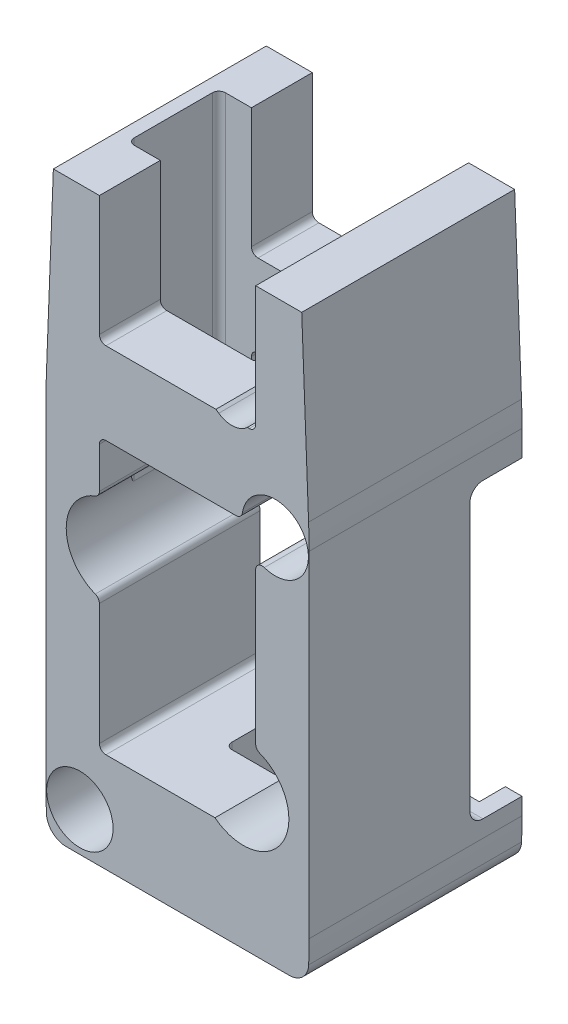
from build123d import *

# Parameters (mm, degrees)
SKETCH1_R               = 7.95
SKETCH1_R_2             = 3
MAIN_BODY_LINK_B1_DEPTH = 32.7
CUT_EXTRUDE2_REACH      = 172.091
CUT_EXTRUDE3_REACH      = 172.091
SKETCH5_R               = 1.5
PULLEYIDLERUP_DEPTH     = 32.7
CUT_EXTRUDE5_DEPTH      = 32.7
FILLET5_R               = 100
SKETCH8_R               = 15.25
CUT_EXTRUDE6_DEPTH      = 171.090551712
SKETCH9_R               = 5.1
SKETCH9_W               = 38.1446978
SKETCH9_H               = 45.516821784
SKETCH9_W_2             = 39.989573096
SKETCH9_H_2             = 49.024052381
CUT_EXTRUDE7_DEPTH      = 171.090551712
SKETCH10_W              = 24
SKETCH10_H              = 41.8
SKETCH10_H_2            = 19.483178216
CUT_EXTRUDE8_DEPTH      = 127.171046068
SKETCH12_R              = 7
CUT_EXTRUDE13_DEPTH     = 127.171046068
SKETCH16_W              = 40.4
SKETCH16_H              = 45
CUT_EXTRUDE18_DEPTH     = 8
SKETCH18_W              = 20
SKETCH18_H              = 14
CUT_EXTRUDE19_DEPTH     = 47
SKETCH19_W              = 20
SKETCH19_H              = 12
CUT_EXTRUDE20_DEPTH     = 20
CUT_EXTRUDE21_DEPTH     = 4
FILLET6_R               = 3
FILLET7_R               = 1
FILLET8_R               = 1
FILLET9_R               = 2


with BuildPart() as part:
    # Sketch1 → Main Body Link B1 (new body)
    with BuildSketch(Plane.XY):
        with BuildLine():
            Line((20.2, 41.674052381), (20.2, 83.474052381))
            Line((20.2, 83.474052381), (20.2, 90.874052381))
            Line((20.2, 90.874052381), (17.986683974, 148.383116621))
            ThreePointArc((17.986683974, 148.383116621), (0, 165.690874165), (-17.986683974, 148.383116621))
            Line((-17.986683974, 148.383116621), (-20.2, 90.874052381))
            Line((-20.2, 90.874052381), (-20.2, 83.474052381))
            Line((-20.2, 83.474052381), (-20.2, 41.674052381))
            Line((-20.2, 41.674052381), (-20.2, 34.274052381))
            Line((-20.2, 34.274052381), (-17.964224051, -1.134307826))
            ThreePointArc((-17.964224051, -1.134307826), (0, -18), (17.964224051, -1.134307826))
            Line((17.964224051, -1.134307826), (20.2, 34.274052381))
            Line((20.2, 34.274052381), (20.2, 41.674052381))
        make_face()
        Circle(SKETCH1_R, mode=Mode.SUBTRACT)
        with Locations((15, 88.174052381)):
            Circle(SKETCH1_R_2, mode=Mode.SUBTRACT)
        with Locations((-15, 37.024052381)):
            Circle(SKETCH1_R_2, mode=Mode.SUBTRACT)
        with Locations((0, 147.690874165)):
            Circle(SKETCH1_R, mode=Mode.SUBTRACT)
    extrude(amount=MAIN_BODY_LINK_B1_DEPTH)

    # Sketch4 → Cut-Extrude2 (cut, up to next)
    with BuildSketch(Plane.XY.offset(32.7), mode=Mode.PRIVATE) as cut_extrude2_sk1:
        with BuildLine():
            Line((-12, 134.2744663), (-12, 123.584968066))
            Line((-12, 123.584968066), (-2.929911079, 129.930929878))
            ThreePointArc((-2.929911079, 129.930929878), (-7.774454217, 131.456408925), (-12, 134.2744663))
        make_face()
    cut_extrude2_tool1 = extrude(cut_extrude2_sk1.sketch, amount=-CUT_EXTRUDE2_REACH, mode=Mode.PRIVATE) & part.part
    # Sketch4 → Cut-Extrude2 (cut, up to next)
    with BuildSketch(Plane.XY.offset(32.7), mode=Mode.PRIVATE) as cut_extrude2_sk2:
        Polygon((-12, 100.690874165), (3.278172542, 100.690874165), (-12, 111.380372399), align=None)
    cut_extrude2_tool2 = extrude(cut_extrude2_sk2.sketch, amount=-CUT_EXTRUDE2_REACH, mode=Mode.PRIVATE) & part.part
    # Sketch4 → Cut-Extrude2 (cut, up to next)
    with BuildSketch(Plane.XY.offset(32.7), mode=Mode.PRIVATE) as cut_extrude2_sk3:
        Polygon((12, 128.172168466), (12, 106.793171999), (-3.278172542, 117.482670232), align=None)
    cut_extrude2_tool3 = extrude(cut_extrude2_sk3.sketch, amount=-CUT_EXTRUDE2_REACH, mode=Mode.PRIVATE) & part.part
    # Sketch4 → Cut-Extrude2 (cut, up to next)
    with BuildSketch(Plane.XY.offset(32.7), mode=Mode.PRIVATE) as cut_extrude2_sk4:
        Polygon((-4.386441158, 88.090874165), (12, 88.090874165), (12, 73.82101499), align=None)
    cut_extrude2_tool4 = extrude(cut_extrude2_sk4.sketch, amount=-CUT_EXTRUDE2_REACH, mode=Mode.PRIVATE) & part.part
    # Sketch4 → Cut-Extrude2 (cut, up to next)
    with BuildSketch(Plane.XY.offset(32.7), mode=Mode.PRIVATE) as cut_extrude2_sk5:
        Polygon((-12, 81.46073334), (-12, 52.92101499), (4.386441158, 67.190874165), align=None)
    cut_extrude2_tool5 = extrude(cut_extrude2_sk5.sketch, amount=-CUT_EXTRUDE2_REACH, mode=Mode.PRIVATE) & part.part
    # Sketch4 → Cut-Extrude2 (cut, up to next)
    with BuildSketch(Plane.XY.offset(32.7), mode=Mode.PRIVATE) as cut_extrude2_sk6:
        Polygon((-4.386441158, 46.290874165), (12, 46.290874165), (12, 60.56073334), align=None)
    cut_extrude2_tool6 = extrude(cut_extrude2_sk6.sketch, amount=-CUT_EXTRUDE2_REACH, mode=Mode.PRIVATE) & part.part
    add(cut_extrude2_tool1.solids().sort_by_distance((-9.12997, 128.978342, 32.7))[0], mode=Mode.SUBTRACT)
    add(cut_extrude2_tool2.solids().sort_by_distance((-6.907276, 104.25404, 32.7))[0], mode=Mode.SUBTRACT)
    add(cut_extrude2_tool3.solids().sort_by_distance((6.907276, 117.48267, 32.7))[0], mode=Mode.SUBTRACT)
    add(cut_extrude2_tool4.solids().sort_by_distance((6.537853, 83.334254, 32.7))[0], mode=Mode.SUBTRACT)
    add(cut_extrude2_tool5.solids().sort_by_distance((-6.537853, 67.190874, 32.7))[0], mode=Mode.SUBTRACT)
    add(cut_extrude2_tool6.solids().sort_by_distance((6.537853, 51.047494, 32.7))[0], mode=Mode.SUBTRACT)

    # Sketch5 → Cut-Extrude3 (cut, up to next)
    with BuildSketch(Plane.XY.offset(32.7), mode=Mode.PRIVATE) as cut_extrude3_sk1:
        with Locations((11.5, 147.690874165)):
            Circle(SKETCH5_R)
    cut_extrude3_tool1 = extrude(cut_extrude3_sk1.sketch, amount=-CUT_EXTRUDE3_REACH, mode=Mode.PRIVATE) & part.part
    # Sketch5 → Cut-Extrude3 (cut, up to next)
    with BuildSketch(Plane.XY.offset(32.7), mode=Mode.PRIVATE) as cut_extrude3_sk2:
        with Locations((-11.5, 147.690874165)):
            Circle(SKETCH5_R)
    cut_extrude3_tool2 = extrude(cut_extrude3_sk2.sketch, amount=-CUT_EXTRUDE3_REACH, mode=Mode.PRIVATE) & part.part
    # Sketch5 → Cut-Extrude3 (cut, up to next)
    with BuildSketch(Plane.XY.offset(32.7), mode=Mode.PRIVATE) as cut_extrude3_sk3:
        with Locations((-11.5, 0)):
            Circle(SKETCH5_R)
    cut_extrude3_tool3 = extrude(cut_extrude3_sk3.sketch, amount=-CUT_EXTRUDE3_REACH, mode=Mode.PRIVATE) & part.part
    # Sketch5 → Cut-Extrude3 (cut, up to next)
    with BuildSketch(Plane.XY.offset(32.7), mode=Mode.PRIVATE) as cut_extrude3_sk4:
        with Locations((11.5, 0)):
            Circle(SKETCH5_R)
    cut_extrude3_tool4 = extrude(cut_extrude3_sk4.sketch, amount=-CUT_EXTRUDE3_REACH, mode=Mode.PRIVATE) & part.part
    add(cut_extrude3_tool1.solids().sort_by_distance((11.5, 147.690874, 32.7))[0], mode=Mode.SUBTRACT)
    add(cut_extrude3_tool2.solids().sort_by_distance((-11.5, 147.690874, 32.7))[0], mode=Mode.SUBTRACT)
    add(cut_extrude3_tool3.solids().sort_by_distance((-11.5, 0, 32.7))[0], mode=Mode.SUBTRACT)
    add(cut_extrude3_tool4.solids().sort_by_distance((11.5, 0, 32.7))[0], mode=Mode.SUBTRACT)

    # Sketch6 → PulleyIdlerUp (cut)
    with BuildSketch(Plane.XY.offset(32.7)):
        with BuildLine():
            Line((-5.959092644, 108.984491566), (6.331359583, 100.385376259))
            ThreePointArc((6.331359583, 100.385376259), (11.205592008, 101.246688207), (10.34428006, 106.120920631))
            Line((10.34428006, 106.120920631), (-1.946172167, 114.720035938))
            ThreePointArc((-1.946172167, 114.720035938), (-6.820404592, 113.85872399), (-5.959092644, 108.984491566))
        make_face()
    extrude(amount=-PULLEYIDLERUP_DEPTH, mode=Mode.SUBTRACT)

    # Sketch7 → Cut-Extrude5 (cut)
    with BuildSketch(Plane.XY.offset(32.7)):
        with BuildLine():
            Line((-11.837342059, 24.015885081), (0.449938606, 15.412238536))
            ThreePointArc((0.449938606, 15.412238536), (5.324488288, 16.271753164), (4.46497366, 21.146302846))
            Line((4.46497366, 21.146302846), (-7.822307004, 29.749949391))
            ThreePointArc((-7.822307004, 29.749949391), (-12.696856686, 28.890434763), (-11.837342059, 24.015885081))
        make_face()
    extrude(amount=-CUT_EXTRUDE5_DEPTH, mode=Mode.SUBTRACT)

    # Fillet5
    # the kernel refuses this fillet: 100 mm, written as the material it takes off along each edge
    with BuildSketch(Plane(origin=(-20.2, 34.274052381, -7.884973578), x_dir=(0, 1, 0), z_dir=(0, 0, 1))) as fillet5_piece_1:
        with BuildLine():
            CenterArc((FILLET5_R * 0.0315398943126, -FILLET5_R), FILLET5_R, 90, 3.613007947)
            Line((-FILLET5_R * 0.0314772071099, -FILLET5_R * 0.00198755271875), (0, 0))
            Line((0, 0), (FILLET5_R * 0.0315398943126, 0))
        make_face()
    extrude(amount=48.469947156, mode=Mode.SUBTRACT)
    with BuildSketch(Plane(origin=(-20.2, 90.874052381, -4.809018086), x_dir=(0.03845791424359976, 0.9992602207793684, 0), z_dir=(0, 0, 1))) as fillet5_piece_2:
        with BuildLine():
            CenterArc((FILLET5_R * 0.0192360723451, -FILLET5_R), FILLET5_R, 90, 2.204019698)
            Line((-FILLET5_R * 0.0192218418985, -FILLET5_R * 0.000739779220632), (0, 0))
            Line((0, 0), (FILLET5_R * 0.0192360723451, 0))
        make_face()
    extrude(amount=42.318036173, mode=Mode.SUBTRACT)
    with BuildSketch(Plane(origin=(20.2, 90.874052381, -4.809018086), x_dir=(-0.03845791424359111, 0.9992602207793686, 0), z_dir=(0, 0, 1))) as fillet5_piece_3:
        with BuildLine():
            CenterArc((FILLET5_R * 0.0192360723451, FILLET5_R), FILLET5_R, 267.795980302, 2.204019698)
            Line((-FILLET5_R * 0.0192218418985, FILLET5_R * 0.000739779220631), (0, 0))
            Line((0, 0), (FILLET5_R * 0.0192360723451, 0))
        make_face()
    extrude(amount=42.318036173, mode=Mode.SUBTRACT)
    with BuildSketch(Plane(origin=(20.2, 34.274052381, -7.884973578), x_dir=(0, 1, 0), z_dir=(0, 0, 1))) as fillet5_piece_4:
        with BuildLine():
            CenterArc((FILLET5_R * 0.0315398943126, FILLET5_R), FILLET5_R, 266.386992053, 3.613007947)
            Line((-FILLET5_R * 0.0314772071099, FILLET5_R * 0.00198755271875), (0, 0))
            Line((0, 0), (FILLET5_R * 0.0315398943126, 0))
        make_face()
    extrude(amount=48.469947156, mode=Mode.SUBTRACT)

    # Sketch8 → Cut-Extrude6 (cut, through all)
    with BuildSketch(Plane.XY.offset(32.7)):
        Circle(SKETCH8_R)
        with Locations((0, 147.690874165)):
            Circle(SKETCH8_R)
    extrude(amount=-CUT_EXTRUDE6_DEPTH, mode=Mode.SUBTRACT)

    # Sketch9 → Cut-Extrude7 (cut, through all)
    with BuildSketch(Plane.XY.offset(32.7)):
        with Locations((15, 88.174052381)):
            Circle(SKETCH9_R)
        with Locations((-15, 37.024052381)):
            Circle(SKETCH9_R)
        with Locations((0, 142.932463273)):
            Rectangle(SKETCH9_W, SKETCH9_H)
        with Locations((0, 6.512026191)):
            Rectangle(SKETCH9_W_2, SKETCH9_H_2)
    extrude(amount=-CUT_EXTRUDE7_DEPTH, mode=Mode.SUBTRACT)

    # Sketch10 → Cut-Extrude8 (cut, through all)
    with BuildSketch(Plane(origin=(0, 0, 0), x_dir=(-1, 0, 0), z_dir=(0, 0, -1))):
        with Locations((0, 67.190874165)):
            Rectangle(SKETCH10_W, SKETCH10_H)
        with Locations((0, 110.432463273)):
            Rectangle(SKETCH10_W, SKETCH10_H_2)
    extrude(amount=-CUT_EXTRUDE8_DEPTH, mode=Mode.SUBTRACT)

    # Sketch12 → Cut-Extrude13 (cut, through all)
    with BuildSketch(Plane.XY.offset(32.7)):
        with Locations((-10.1, 73.374052381)):
            Circle(SKETCH12_R)
        with Locations((10.1, 51.774052381)):
            Circle(SKETCH12_R)
    extrude(amount=-CUT_EXTRUDE13_DEPTH, mode=Mode.SUBTRACT)

    # Sketch16 → Cut-Extrude18 (cut)
    with BuildSketch(Plane(origin=(0, 0, 0), x_dir=(-1, 0, 0), z_dir=(0, 0, -1))):
        with Locations((0, 62.524052381)):
            Rectangle(SKETCH16_W, SKETCH16_H)
    extrude(amount=-CUT_EXTRUDE18_DEPTH, mode=Mode.SUBTRACT)

    # Sketch18 → Cut-Extrude19 (cut)
    with BuildSketch(Plane(origin=(0, 120.174052381, 0), x_dir=(1, 0, 0), z_dir=(0, 1, 0))):
        with Locations((-7, -16.35)):
            Rectangle(SKETCH18_W, SKETCH18_H)
    extrude(amount=-CUT_EXTRUDE19_DEPTH, mode=Mode.SUBTRACT)

    # Sketch19 → Cut-Extrude20 (cut)
    with BuildSketch(Plane.XZ.offset(-31.024052381)):
        with Locations((6.994786548, 16.35)):
            Rectangle(SKETCH19_W, SKETCH19_H)
    extrude(amount=-CUT_EXTRUDE20_DEPTH, mode=Mode.SUBTRACT)

    # Sketch20 → Cut-Extrude21 (cut)
    with BuildSketch(Plane(origin=(0, 0, 0), x_dir=(-1, 0, 0), z_dir=(0, 0, -1))):
        with BuildLine():
            Line((-15, 92.174052381), (15, 92.174052381))
            ThreePointArc((15, 92.174052381), (19, 88.174052381), (15, 84.174052381))
            Line((15, 84.174052381), (-15, 84.174052381))
            ThreePointArc((-15, 84.174052381), (-19, 88.174052381), (-15, 92.174052381))
        make_face()
        with BuildLine():
            Line((15, 33.024052381), (-15, 33.024052381))
            ThreePointArc((-15, 33.024052381), (-19, 37.024052381), (-15, 41.024052381))
            Line((-15, 41.024052381), (15, 41.024052381))
            ThreePointArc((15, 41.024052381), (19, 37.024052381), (15, 33.024052381))
        make_face()
    extrude(amount=-CUT_EXTRUDE21_DEPTH, mode=Mode.SUBTRACT)

    # Fillet6
    fillet6_edges = [part.edges().sort_by_distance(p)[0] for p in [
        (19.994786548, 31.024052381, 16.35),
        (-19.994786548, 31.024052381, 16.35),
    ]]
    fillet(fillet6_edges, radius=FILLET6_R)

    # Fillet7
    fillet7_edges = [part.edges().sort_by_distance(p)[0] for p in [
        (12, 84.049734256, 20.35),
        (-12, 46.290874165, 20.35),
        (-12, 88.090874165, 28.025),
        (12, 100.690874165, 16.35),
        (-12, 80.111262487, 28.025),
        (12, 58.511262487, 20.35),
        (-12, 66.636842276, 20.35),
        (-12, 80.111262487, 8.675),
        (-12, 88.090874165, 6.675),
        (-12, 100.690874165, 28.025),
        (9.900678341, 88.090874165, 18.35),
        (-12, 100.690874165, 4.675),
    ]]
    fillet(fillet7_edges, radius=FILLET7_R)

    # Fillet8
    fillet8_edges = [part.edges().sort_by_distance(p)[0] for p in [
        (3, 94.390874165, 9.35),
        (-17, 97.363543688, 23.35),
        (-17, 97.363543688, 9.35),
        (3, 94.390874165, 23.35),
        (-3.005213452, 38.657463273, 10.35),
        (16.994786548, 40.794503281, 22.35),
        (16.994786548, 40.794503281, 10.35),
        (-3.005213452, 38.657463273, 22.35),
    ]]
    fillet(fillet8_edges, radius=FILLET8_R)

    # Fillet9
    fillet9_edges = [part.edges().sort_by_distance(p)[0] for p in [
        (4.662159063, 40.024052381, 8),
        (-16.1, 85.024052381, 8),
        (19.605461294, 85.024052381, 8),
        (-19.662159063, 40.024052381, 8),
    ]]
    fillet(fillet9_edges, radius=FILLET9_R)


solid = part.part
